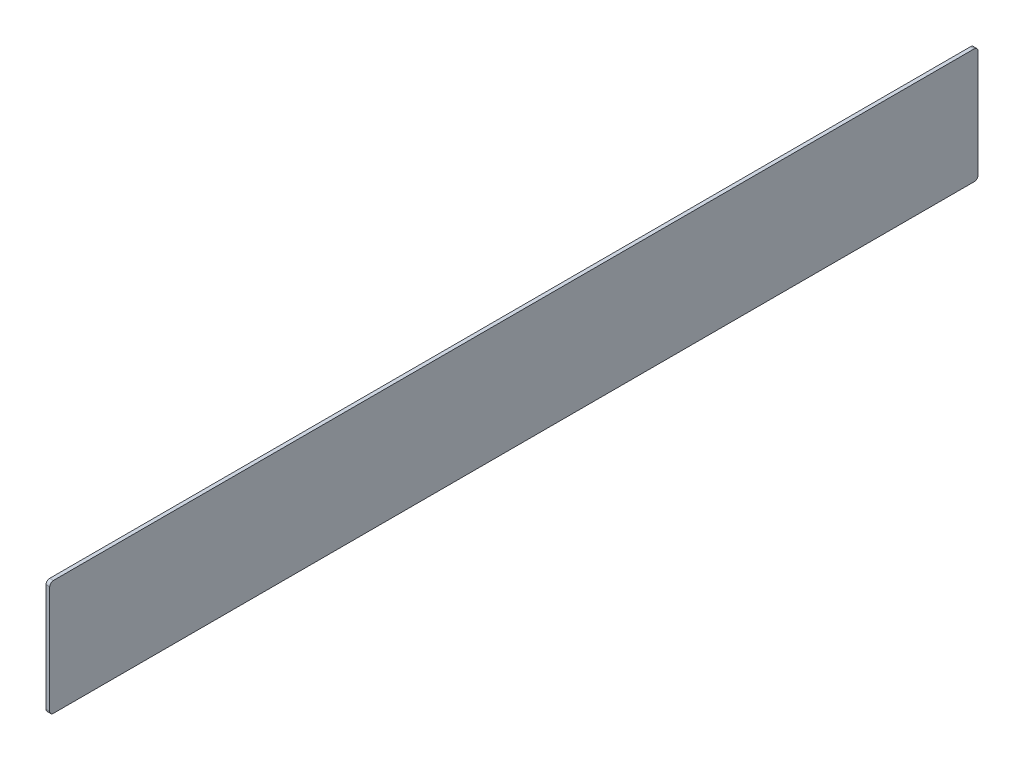
from build123d import *

# Parameters (mm, degrees)
SKETCH1_W           = 500
SKETCH1_H           = 62
BOSS_EXTRUDE1_DEPTH = 2
FILLET1_R           = 2


with BuildPart() as part:
    # Sketch1 → Boss-Extrude1 (new body)
    with BuildSketch(Plane(origin=(0, 0, 0), x_dir=(0, 0, -1), z_dir=(1, 0, 0))):
        with Locations((-19.946808511, -109.292553191)):
            Rectangle(SKETCH1_W, SKETCH1_H)
    extrude(amount=BOSS_EXTRUDE1_DEPTH)

    # Fillet1
    fillet1_edges = [part.edges().sort_by_distance(p)[0] for p in [
        (1, -140.292553191, -230.053191489),
        (1, -78.292553191, -230.053191489),
        (1, -140.292553191, 269.946808511),
        (1, -78.292553191, 269.946808511),
    ]]
    fillet(fillet1_edges, radius=FILLET1_R)


solid = part.part
